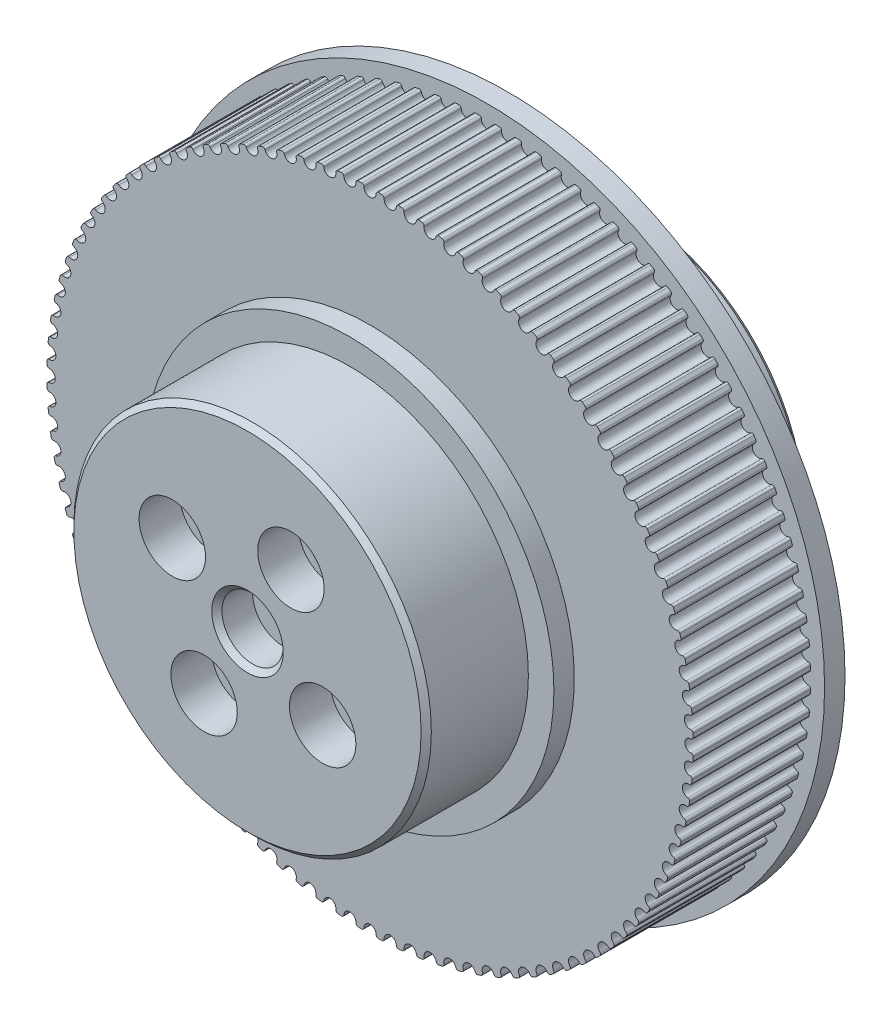
from build123d import *

# Parameters (mm, degrees)
SKETCHREVOLVEGEARBELT01_W       = 11.5
SKETCHREVOLVEGEARBELT01_H       = 31.640488143
TOOTHEXTRUDECUTGEARBELT01_DEPTH = 11.5
PATTERNGEARBELT01_COUNT         = 100
SKETCH_20_R                     = 33
EXTRUDE_10_DEPTH                = 2
SKETCH_12_R                     = 20
EXTRUDE_5_DEPTH                 = 2
EXTRUDE_START                   = 2
SKETCH_6_R                      = 20
EXTRUDE_6_DEPTH                 = 2
SKETCH_13_R                     = 17.5
EXTRUDE_7_DEPTH                 = 10
EXTRUDE_START_2                 = 10
SKETCH_14_R                     = 17.5
EXTRUDE_8_DEPTH                 = 10
SKETCH_15_R                     = 12.1
CUT_EXTRUDE_1_DEPTH             = 7
CUT_EXTRUDE_2_DEPTH             = 54.181293704
CUT_EXTRUDE_2_DEPTH_BACK        = 54.181293704
SKETCH_16_R                     = 1.75
SKETCH_17_R                     = 3.25
CUT_EXTRUDE_3_DEPTH             = 4
SKETCH_18_R                     = 3
CUT_EXTRUDE_4_DEPTH             = 3.5
CUT_EXTRUDE_5_DEPTH             = 54.181293704
CUT_EXTRUDE_5_DEPTH_BACK        = 54.181293704
SKETCH_19_R                     = 1
CHAMFER_1_SIZE                  = 0.5
FILLET_1_R                      = 0.4
CHAMFER_2_SIZE                  = 0.5


with BuildPart() as part:
    # SketchRevolveGearBelt01 → GearBelt01 (revolve)
    with BuildSketch(Plane(origin=(0, 0, 0), x_dir=(0, 0, -1), z_dir=(1, 0, 0)), mode=Mode.PRIVATE) as gearbelt01_sk:
        with Locations((5.75, 15.820244072)):
            Rectangle(SKETCHREVOLVEGEARBELT01_W, SKETCHREVOLVEGEARBELT01_H)
    revolve(gearbelt01_sk.sketch.rotate(Axis((0, 0, 0), (0, 0, -1)), 90), axis=Axis((0, 0, 0), (0, 0, -1)))

    # SketchToothGearBelt01 → ToothExtrudeCutGearBelt01 (cut)
    with BuildSketch(Plane.XY):
        with BuildLine():
            Line((-0.813963777, 31.630016644), (0, 34.180488105))
            Line((0, 34.180488105), (0.813963777, 31.630016644))
            ThreePointArc((0.813963777, 31.630016644), (0.663006412, 31.570874086), (0.599999991, 31.421488146))
            ThreePointArc((0.599999991, 31.421488146), (0, 30.821488155), (-0.599999991, 31.421488146))
            ThreePointArc((-0.599999991, 31.421488146), (-0.663006412, 31.570874086), (-0.813963777, 31.630016644))
        make_face()
    toothextrudecutgearbelt01 = extrude(amount=-TOOTHEXTRUDECUTGEARBELT01_DEPTH, mode=Mode.SUBTRACT)

    # PatternGearBelt01: ToothExtrudeCutGearBelt01 ×100 about axis
    patterngearbelt01_axis = Axis((0, 0, 0), (0, 0, 1))
    for i in range(1, PATTERNGEARBELT01_COUNT):
        add(toothextrudecutgearbelt01.rotate(patterngearbelt01_axis, i * 360 / PATTERNGEARBELT01_COUNT), mode=Mode.SUBTRACT)

    # Эскиз20 → Бобышка-Вытянуть10 (add)
    with BuildSketch(Plane(origin=(0, 0, -11.5), x_dir=(-1, 0, 0), z_dir=(0, 0, -1))):
        Circle(SKETCH_20_R)
    extrude(amount=EXTRUDE_10_DEPTH)

    # Эскиз12 → Бобышка-Вытянуть5 (add)
    with BuildSketch(Plane(origin=(0, 0, -13.5), x_dir=(-1, 0, 0), z_dir=(0, 0, -1))):
        Circle(SKETCH_12_R)
    extrude(amount=EXTRUDE_5_DEPTH)

    # Эскиз6 → Бобышка-Вытянуть6 (add)
    with BuildSketch(Plane.XY.offset(EXTRUDE_START)):
        with Locations(Location((0, 0, 0), (0, 0, 180))):
            Circle(SKETCH_6_R)
    extrude(amount=-EXTRUDE_6_DEPTH)

    # Эскиз13 → Бобышка-Вытянуть7 (add)
    with BuildSketch(Plane.XY.offset(2)):
        Circle(SKETCH_13_R)
    extrude(amount=EXTRUDE_7_DEPTH)

    # Эскиз14 → Бобышка-Вытянуть8 (add)
    with BuildSketch(Plane(origin=(0, 0, -15.5), x_dir=(-1, 0, 0), z_dir=(0, 0, -1)).offset(EXTRUDE_START_2)):
        with Locations(Location((0, 0, 0), (0, 0, 180))):
            Circle(SKETCH_14_R)
    extrude(amount=-EXTRUDE_8_DEPTH)

    # Эскиз15 → Вырез-Вытянуть1 (cut)
    with BuildSketch(Plane(origin=(0, 0, -25.5), x_dir=(-1, 0, 0), z_dir=(0, 0, -1))):
        Circle(SKETCH_15_R)
    extrude(amount=-CUT_EXTRUDE_1_DEPTH, mode=Mode.SUBTRACT)

    # Эскиз16 → Вырез-Вытянуть2 (cut, two sides: drawn at the far end of the back side and taken through both)
    with BuildSketch(Plane.XY.offset(-CUT_EXTRUDE_2_DEPTH_BACK)):
        with Locations((4.25, 7.361215932)):
            Circle(SKETCH_16_R)
        with Locations((7.361215932, -4.25)):
            Circle(SKETCH_16_R)
        with Locations((-4.25, -7.361215932)):
            Circle(SKETCH_16_R)
        with Locations((-7.361215932, 4.25)):
            Circle(SKETCH_16_R)
    extrude(amount=CUT_EXTRUDE_2_DEPTH + CUT_EXTRUDE_2_DEPTH_BACK, mode=Mode.SUBTRACT)

    # Эскиз17 → Вырез-Вытянуть3 (cut)
    with BuildSketch(Plane.XY.offset(12)):
        with Locations((4.25, 7.361215932)):
            Circle(SKETCH_17_R)
        with Locations((7.361215932, -4.25)):
            Circle(SKETCH_17_R)
        with Locations((-4.25, -7.361215932)):
            Circle(SKETCH_17_R)
        with Locations((-7.361215932, 4.25)):
            Circle(SKETCH_17_R)
    extrude(amount=-CUT_EXTRUDE_3_DEPTH, mode=Mode.SUBTRACT)

    # Эскиз18 → Вырез-Вытянуть4 (cut)
    with BuildSketch(Plane.XY.offset(12)):
        Circle(SKETCH_18_R)
    extrude(amount=-CUT_EXTRUDE_4_DEPTH, mode=Mode.SUBTRACT)

    # Эскиз19 → Вырез-Вытянуть5 (cut, two sides: drawn at the far end of the back side and taken through both)
    with BuildSketch(Plane.XY.offset(-CUT_EXTRUDE_5_DEPTH_BACK)):
        Circle(SKETCH_19_R)
    extrude(amount=CUT_EXTRUDE_5_DEPTH + CUT_EXTRUDE_5_DEPTH_BACK, mode=Mode.SUBTRACT)

    # Фаска1
    chamfer_1_edges = [part.edges().sort_by_distance(p)[0] for p in [
        (-17.5, 0, 12),
        (-17.5, 0, -25.5),
        (12.1, 0, -25.5),
    ]]
    chamfer(chamfer_1_edges, length=CHAMFER_1_SIZE)

    # Скругление1
    fillet_1_edges = [part.edges().sort_by_distance(p)[0] for p in [
        (12.1, 0, -18.5),
    ]]
    fillet(fillet_1_edges, radius=FILLET_1_R)

    # Фаска2
    chamfer_2_edges = [part.edges().sort_by_distance(p)[0] for p in [
        (-3, 0, 12),
    ]]
    chamfer(chamfer_2_edges, length=CHAMFER_2_SIZE)


solid = part.part
